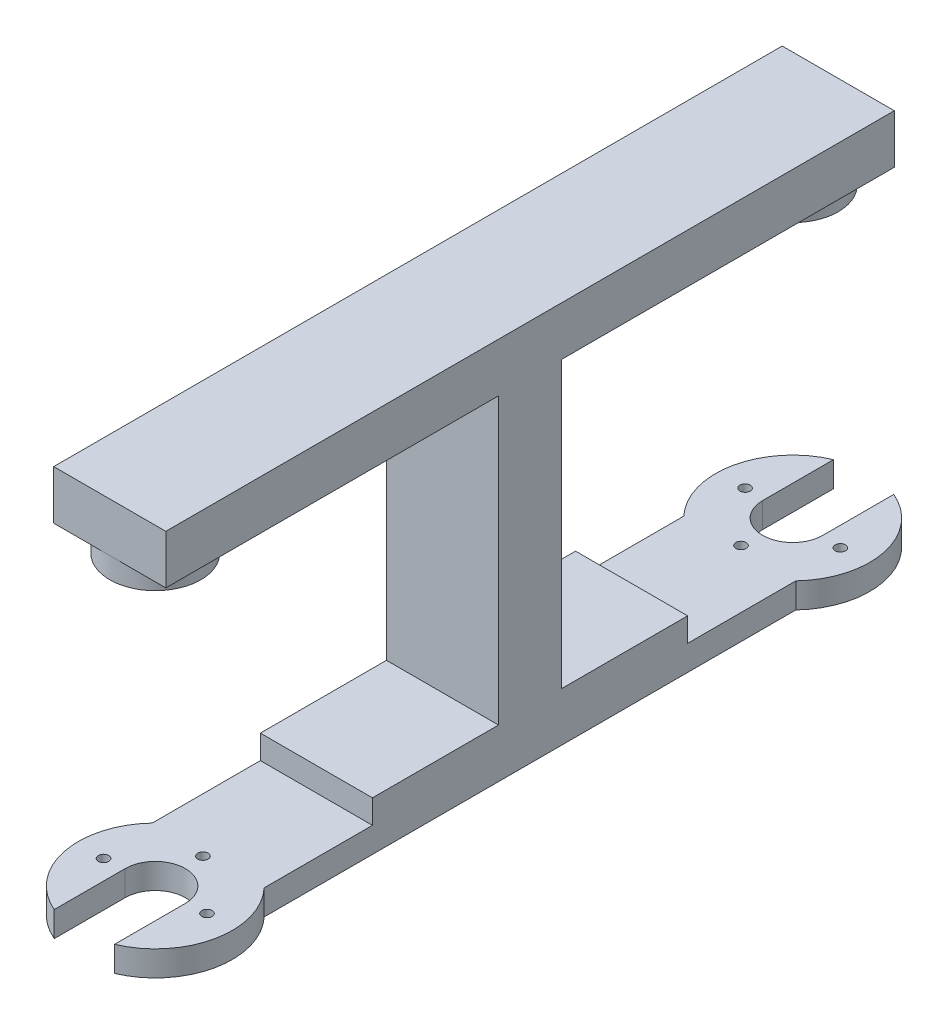
from build123d import *

# Parameters (mm, degrees)
EXTRUDE_1_DEPTH     = 16
CUT_EXTRUDE_1_DEPTH = 3
EXTRUDE_START       = -44.7
EXTRUDE_2_DEPTH     = 7
CUT_EXTRUDE_START   = -44.7
CUT_EXTRUDE_2_DEPTH = 7
SKETCH_4_W          = 33.124722218
SKETCH_4_H          = 3.4
CUT_EXTRUDE_3_DEPTH = 25
CUT_EXTRUDE_4_REACH = 79.827
SKETCH_6_R          = 0.74


# Read off the part's stored shape, not the designer's step: 凸台-拉伸2, 切除-拉伸2
with BuildPart() as part:
    # 草图1 → 凸台-拉伸1 (new body)
    with BuildSketch(Plane(origin=(0, 0, 0), x_dir=(0, 0, -1), z_dir=(1, 0, 0))):
        Polygon((0, 0), (13, 0), (13, 3), (47.5, 3), (47.5, -37.7), (0, -37.7), (0, -44.7), (52, -44.7), (52, 10), (0, 10), align=None)
    extrude_1 = extrude(amount=EXTRUDE_1_DEPTH)

    # 草图2 → 切除-拉伸1 (cut)
    with BuildSketch(Plane.XZ):
        with BuildLine():
            Line((8, 0), (0, 0))
            Line((0, 0), (0, -6.5))
            Line((0, -6.5), (0, -13))
            Line((0, -13), (8.000000017, -13))
            ThreePointArc((8.000000017, -13), (1.5, -6.500000009), (8, 0))
        make_face()
        with BuildLine():
            Line((16, 0), (8, 0))
            ThreePointArc((8, 0), (12.596194078, -1.903805922), (14.5, -6.5))
            ThreePointArc((14.5, -6.5), (12.596194084, -11.096194072), (8.000000017, -13))
            Line((8.000000017, -13), (16, -13))
            Line((16, -13), (16, 0))
        make_face()
    cut_extrude_1 = extrude(amount=-CUT_EXTRUDE_1_DEPTH, mode=Mode.SUBTRACT)

    # 凸台-拉伸2 outline → 凸台-拉伸2 (add)
    with BuildSketch(Plane(origin=(0, 0, 0), x_dir=(1, 0, 0), z_dir=(0, 1, 0)).offset(EXTRUDE_START)):
        with BuildLine():
            ThreePointArc((0, 14.049834435), (8, -4.5), (16, 14.049834435))
            Line((16, 14.049834435), (16, 0))
            Line((16, 0), (0, 0))
            Line((0, 0), (0, 14.049834435))
        make_face()
    extrude_2 = extrude(amount=EXTRUDE_2_DEPTH)

    # 切除-拉伸2 outline → 切除-拉伸2 (cut)
    with BuildSketch(Plane(origin=(0, 0, 0), x_dir=(1, 0, 0), z_dir=(0, 1, 0)).offset(CUT_EXTRUDE_START)):
        with BuildLine():
            ThreePointArc((12.3, 6.5), (8, 10.8), (3.7, 6.5))
            Line((3.7, 6.5), (3.7, -3.624722218))
            ThreePointArc((3.7, -3.624722218), (8, -4.5), (12.3, -3.624722218))
            Line((12.3, -3.624722218), (12.3, 6.5))
        make_face()
    cut_extrude_2 = extrude(amount=CUT_EXTRUDE_2_DEPTH, mode=Mode.SUBTRACT)

    # 草图4 → 切除-拉伸3 (cut, symmetric)
    with BuildSketch(Plane.ZY):
        with Locations((-12.937638891, -39.4)):
            Rectangle(SKETCH_4_W, SKETCH_4_H)
    cut_extrude_3 = extrude(amount=CUT_EXTRUDE_3_DEPTH, both=True, mode=Mode.SUBTRACT)

    # 草图6 → 切除-拉伸4 (cut, up to next)
    with BuildSketch(Plane.XZ.offset(44.7), mode=Mode.PRIVATE) as cut_extrude_4_sk1:
        with Locations(Location((0.90598139, -6.208624029, 0), (0, 0, 270))):
            Circle(SKETCH_6_R)
    cut_extrude_4_tool1 = extrude(cut_extrude_4_sk1.sketch, amount=-CUT_EXTRUDE_4_REACH, mode=Mode.PRIVATE) & part.part
    # 草图6 → 切除-拉伸4 (cut, up to next)
    with BuildSketch(Plane.XZ.offset(44.7), mode=Mode.PRIVATE) as cut_extrude_4_sk2:
        with Locations(Location((7.708624029, -13.59401861, 0), (0, 0, 270))):
            Circle(SKETCH_6_R)
    cut_extrude_4_tool2 = extrude(cut_extrude_4_sk2.sketch, amount=-CUT_EXTRUDE_4_REACH, mode=Mode.PRIVATE) & part.part
    # 草图6 → 切除-拉伸4 (cut, up to next)
    with BuildSketch(Plane.XZ.offset(44.7), mode=Mode.PRIVATE) as cut_extrude_4_sk3:
        with Locations(Location((15.09401861, -6.791375971, 0), (0, 0, 270))):
            Circle(SKETCH_6_R)
    cut_extrude_4_tool3 = extrude(cut_extrude_4_sk3.sketch, amount=-CUT_EXTRUDE_4_REACH, mode=Mode.PRIVATE) & part.part
    cut_extrude_4_1 = cut_extrude_4_tool1.solids().sort_by_distance((0.905981, -44.7, -6.208624))[0]
    add(cut_extrude_4_1, mode=Mode.SUBTRACT)
    cut_extrude_4_2 = cut_extrude_4_tool2.solids().sort_by_distance((7.708624, -44.7, -13.594019))[0]
    add(cut_extrude_4_2, mode=Mode.SUBTRACT)
    cut_extrude_4_3 = cut_extrude_4_tool3.solids().sort_by_distance((15.094019, -44.7, -6.791376))[0]
    add(cut_extrude_4_3, mode=Mode.SUBTRACT)
    cut_extrude_4 = cut_extrude_4_1 + cut_extrude_4_2 + cut_extrude_4_3  # 切除-拉伸4 as one shape, for the pattern or mirror that repeats it

    # 镜向1: 凸台-拉伸1, 切除-拉伸1, 凸台-拉伸2, 切除-拉伸2, 切除-拉伸3, 切除-拉伸4 across plane
    add(extrude_1.mirror(Plane(origin=(16, -44.7, -52), x_dir=(1, 0, 0), z_dir=(0, 0, 1))))
    add(cut_extrude_1.mirror(Plane(origin=(16, -44.7, -52), x_dir=(1, 0, 0), z_dir=(0, 0, 1))), mode=Mode.SUBTRACT)
    add(extrude_2.mirror(Plane(origin=(16, -44.7, -52), x_dir=(1, 0, 0), z_dir=(0, 0, 1))))
    add(cut_extrude_2.mirror(Plane(origin=(16, -44.7, -52), x_dir=(1, 0, 0), z_dir=(0, 0, 1))), mode=Mode.SUBTRACT)
    add(cut_extrude_3.mirror(Plane(origin=(16, -44.7, -52), x_dir=(1, 0, 0), z_dir=(0, 0, 1))), mode=Mode.SUBTRACT)
    add(cut_extrude_4.mirror(Plane(origin=(16, -44.7, -52), x_dir=(1, 0, 0), z_dir=(0, 0, 1))), mode=Mode.SUBTRACT)


solid = part.part
